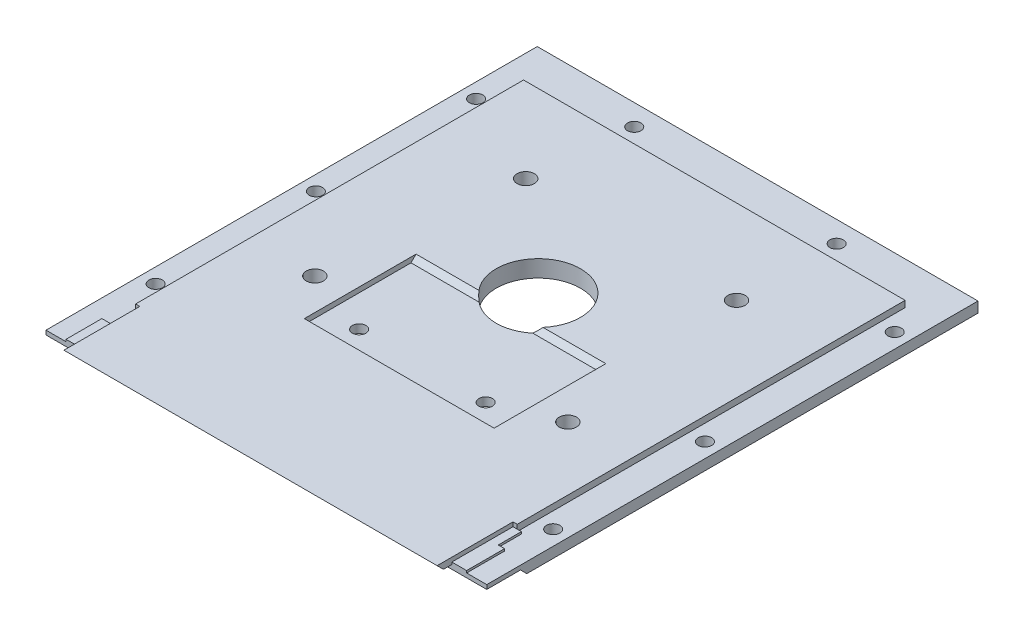
from build123d import *

# Parameters (mm, degrees)
SKETCH_1_W           = 90.5
SKETCH_1_H           = 97
EXTRUDE_1_DEPTH      = 2
SKETCH_2_W           = 104.525
SKETCH_2_H           = 124
SKETCH_2_R           = 1.6
EXTRUDE_2_DEPTH      = 2.5
SKETCH_3_W           = 88.5
SKETCH_3_H           = 17
EXTRUDE_3_DEPTH      = 2
SKETCH_4_W           = 1
SKETCH_4_H           = 5
CUT_EXTRUDE_1_DEPTH  = 2
CUT_EXTRUDE_2_DEPTH  = 150.601890446
SKETCH_6_W           = 45
SKETCH_6_H           = 25
CUT_EXTRUDE_3_DEPTH  = 1.7
CUT_EXTRUDE_4_REACH  = 146.972
SKETCH_7_R           = 1.6
CHAMFER_1_SIZE       = 2
CUT_EXTRUDE_5_REACH  = 147.014
SKETCH_8_R           = 2.05
CUT_EXTRUDE_6_REACH  = 147.014
SKETCH_9_R           = 10
CUT_EXTRUDE_7_DEPTH  = 0.8
CUT_EXTRUDE_8_REACH  = 151.602
SKETCH_11_W          = 6.5
SKETCH_11_H          = 2.5
CHAMFER_2_SIZE       = 2
SKETCH_12_W          = 104.525
SKETCH_12_H          = 9.5
EXTRUDE_4_DEPTH      = 1
SKETCH_13_W          = 2
SKETCH_13_H          = 14.5
EXTRUDE_5_DEPTH      = 0.5
SKETCH_14_W          = 1.5
SKETCH_14_H          = 9
SKETCH_14_W_2        = 1
EXTRUDE_6_DEPTH      = 0.5
SKETCH_15_W          = 88.5
SKETCH_15_H          = 2.828427125
EXTRUDE_7_DEPTH      = 2
CUT_EXTRUDE_9_DEPTH  = 0.5
SKETCH_17_W          = 2
SKETCH_17_H          = 6
CUT_EXTRUDE_10_DEPTH = 0.5


with BuildPart() as part:
    # 草图1 → 凸台-拉伸1 (new body)
    with BuildSketch(Plane(origin=(0, 0, 0), x_dir=(1, 0, 0), z_dir=(0, 1, 0))):
        with Locations((45.25, 48.5)):
            Rectangle(SKETCH_1_W, SKETCH_1_H)
    extrude(amount=EXTRUDE_1_DEPTH)

    # 草图2 → 凸台-拉伸2 (add)
    with BuildSketch(Plane.XZ):
        with Locations((45.5125, -45)):
            Rectangle(SKETCH_2_W, SKETCH_2_H)
        with Locations(Location((21.25, -102, 0), (0, 0, 270))):
            Circle(SKETCH_2_R, mode=Mode.SUBTRACT)
        with Locations(Location((69.25, -102, 0), (0, 0, 270))):
            Circle(SKETCH_2_R, mode=Mode.SUBTRACT)
        with Locations(Location((-3.25, -89, 0), (0, 0, 270))):
            Circle(SKETCH_2_R, mode=Mode.SUBTRACT)
        with Locations(Location((94.275, -90.75, 0), (0, 0, 270))):
            Circle(SKETCH_2_R, mode=Mode.SUBTRACT)
        with Locations(Location((-3.25, -13, 0), (0, 0, 270))):
            Circle(SKETCH_2_R, mode=Mode.SUBTRACT)
        with Locations(Location((-3.25, -51, 0), (0, 0, 270))):
            Circle(SKETCH_2_R, mode=Mode.SUBTRACT)
        with Locations(Location((94.275, -9.75, 0), (0, 0, 270))):
            Circle(SKETCH_2_R, mode=Mode.SUBTRACT)
        with Locations(Location((94.275, -45.75, 0), (0, 0, 270))):
            Circle(SKETCH_2_R, mode=Mode.SUBTRACT)
    extrude(amount=EXTRUDE_2_DEPTH)

    # 草图3 → 凸台-拉伸3 (add)
    with BuildSketch(Plane(origin=(0, 0, 0), x_dir=(1, 0, 0), z_dir=(0, 1, 0))):
        with Locations((45.25, -8.5)):
            Rectangle(SKETCH_3_W, SKETCH_3_H)
    extrude(amount=EXTRUDE_3_DEPTH)

    # 草图4 → 切除-拉伸1 (cut)
    with BuildSketch(Plane(origin=(0, 0, 0), x_dir=(1, 0, 0), z_dir=(0, 1, 0))):
        with Locations((0.5, 2.5)):
            Rectangle(SKETCH_4_W, SKETCH_4_H)
        with Locations((90, 2.5)):
            Rectangle(SKETCH_4_W, SKETCH_4_H)
    extrude(amount=CUT_EXTRUDE_1_DEPTH, mode=Mode.SUBTRACT)

    # 草图5 → 切除-拉伸2 (cut, through all)
    with BuildSketch(Plane(origin=(97.775, 0, 0), x_dir=(0, 0, -1), z_dir=(1, 0, 0))):
        Polygon((-8.5, -2.5), (-8.5, 0), (-9.5, 0), (-11.5, 2), (-17, 2), (-17, -2.5), align=None)
    extrude(amount=-CUT_EXTRUDE_2_DEPTH, mode=Mode.SUBTRACT)

    # 草图6 → 切除-拉伸3 (cut)
    with BuildSketch(Plane(origin=(0, 2, 0), x_dir=(1, 0, 0), z_dir=(0, 1, 0))):
        with Locations((45.5125, 34.5)):
            Rectangle(SKETCH_6_W, SKETCH_6_H)
    extrude(amount=-CUT_EXTRUDE_3_DEPTH, mode=Mode.SUBTRACT)

    # 草图7 → 切除-拉伸4 (cut, up to next)
    with BuildSketch(Plane(origin=(0, 0.3, 0), x_dir=(1, 0, 0), z_dir=(0, 1, 0)), mode=Mode.PRIVATE) as cut_extrude_4_sk1:
        with Locations(Location((30.5125, 27.5, 0), (0, 0, 270))):
            Circle(SKETCH_7_R)
    cut_extrude_4_tool1 = extrude(cut_extrude_4_sk1.sketch, amount=-CUT_EXTRUDE_4_REACH, mode=Mode.PRIVATE) & part.part
    # 草图7 → 切除-拉伸4 (cut, up to next)
    with BuildSketch(Plane(origin=(0, 0.3, 0), x_dir=(1, 0, 0), z_dir=(0, 1, 0)), mode=Mode.PRIVATE) as cut_extrude_4_sk2:
        with Locations(Location((60.5125, 27.5, 0), (0, 0, 270))):
            Circle(SKETCH_7_R)
    cut_extrude_4_tool2 = extrude(cut_extrude_4_sk2.sketch, amount=-CUT_EXTRUDE_4_REACH, mode=Mode.PRIVATE) & part.part
    add(cut_extrude_4_tool1.solids().sort_by_distance((30.5125, 0.3, -27.5))[0], mode=Mode.SUBTRACT)
    add(cut_extrude_4_tool2.solids().sort_by_distance((60.5125, 0.3, -27.5))[0], mode=Mode.SUBTRACT)

    # 倒角1
    # the kernel refuses this chamfer: 2 mm, written as the material it adds along each edge
    # the kernel refuses this chamfer: 2 mm, written as the material it takes off along each edge
    with BuildSketch(Plane(origin=(23.0125, 2, -47), x_dir=(0, 0.027495876610586296, -0.9996219169112968), z_dir=(1, 0, 0))) as chamfer_1_2_piece_1_section:
        Polygon((CHAMFER_1_SIZE * 0.999621916911, -CHAMFER_1_SIZE * 0.0274958766106), (-CHAMFER_1_SIZE * 0.0274958766106, -CHAMFER_1_SIZE * 0.999621916911), (0, 0), align=None)
    chamfer_1_2_piece_1 = extrude(amount=45, mode=Mode.PRIVATE)
    chamfer_1_2_piece_1 = split(chamfer_1_2_piece_1, bisect_by=Plane(origin=(45.5125, 0.3, -47.679710145), z_dir=(0, 1, 0)), keep=Keep.TOP, mode=Mode.PRIVATE)
    add(chamfer_1_2_piece_1, mode=Mode.SUBTRACT)

    # 草图8 → 切除-拉伸5 (cut, up to next)
    with BuildSketch(Plane(origin=(0, 2, 0), x_dir=(1, 0, 0), z_dir=(0, 1, 0)), mode=Mode.PRIVATE) as cut_extrude_5_sk1:
        with Locations(Location((20.5125, 77, 0), (0, 0, 270))):
            Circle(SKETCH_8_R)
    cut_extrude_5_tool1 = extrude(cut_extrude_5_sk1.sketch, amount=-CUT_EXTRUDE_5_REACH, mode=Mode.PRIVATE) & part.part
    # 草图8 → 切除-拉伸5 (cut, up to next)
    with BuildSketch(Plane(origin=(0, 2, 0), x_dir=(1, 0, 0), z_dir=(0, 1, 0)), mode=Mode.PRIVATE) as cut_extrude_5_sk2:
        with Locations(Location((70.5125, 77, 0), (0, 0, 270))):
            Circle(SKETCH_8_R)
    cut_extrude_5_tool2 = extrude(cut_extrude_5_sk2.sketch, amount=-CUT_EXTRUDE_5_REACH, mode=Mode.PRIVATE) & part.part
    # 草图8 → 切除-拉伸5 (cut, up to next)
    with BuildSketch(Plane(origin=(0, 2, 0), x_dir=(1, 0, 0), z_dir=(0, 1, 0)), mode=Mode.PRIVATE) as cut_extrude_5_sk3:
        with Locations(Location((15.5125, 32, 0), (0, 0, 270))):
            Circle(SKETCH_8_R)
    cut_extrude_5_tool3 = extrude(cut_extrude_5_sk3.sketch, amount=-CUT_EXTRUDE_5_REACH, mode=Mode.PRIVATE) & part.part
    # 草图8 → 切除-拉伸5 (cut, up to next)
    with BuildSketch(Plane(origin=(0, 2, 0), x_dir=(1, 0, 0), z_dir=(0, 1, 0)), mode=Mode.PRIVATE) as cut_extrude_5_sk4:
        with Locations(Location((75.5125, 32, 0), (0, 0, 270))):
            Circle(SKETCH_8_R)
    cut_extrude_5_tool4 = extrude(cut_extrude_5_sk4.sketch, amount=-CUT_EXTRUDE_5_REACH, mode=Mode.PRIVATE) & part.part
    add(cut_extrude_5_tool1.solids().sort_by_distance((20.5125, 2, -77))[0], mode=Mode.SUBTRACT)
    add(cut_extrude_5_tool2.solids().sort_by_distance((70.5125, 2, -77))[0], mode=Mode.SUBTRACT)
    add(cut_extrude_5_tool3.solids().sort_by_distance((15.5125, 2, -32))[0], mode=Mode.SUBTRACT)
    add(cut_extrude_5_tool4.solids().sort_by_distance((75.5125, 2, -32))[0], mode=Mode.SUBTRACT)

    # 草图9 → 切除-拉伸6 (cut, up to next)
    with BuildSketch(Plane(origin=(0, 2, 0), x_dir=(1, 0, 0), z_dir=(0, 1, 0)), mode=Mode.PRIVATE) as cut_extrude_6_sk1:
        with Locations(Location((45.5125, 55, 0), (0, 0, 230.353888853))):
            Circle(SKETCH_9_R)
    cut_extrude_6_tool1 = extrude(cut_extrude_6_sk1.sketch, amount=-CUT_EXTRUDE_6_REACH, mode=Mode.PRIVATE) & part.part
    add(cut_extrude_6_tool1.solids().sort_by_distance((45.5125, 2, -55))[0], mode=Mode.SUBTRACT)

    # 草图10 → 切除-拉伸7 (cut)
    with BuildSketch(Plane.XZ.offset(2.5)):
        Polygon((27.7625, -25.91228676), (27.7625, -29.08771324), (30.5125, -30.675426481), (33.2625, -29.08771324), (33.2625, -25.91228676), (30.5125, -24.324573519), align=None)
        Polygon((57.7625, -25.91228676), (57.7625, -29.08771324), (60.5125, -30.675426481), (63.2625, -29.08771324), (63.2625, -25.91228676), (60.5125, -24.324573519), align=None)
    extrude(amount=-CUT_EXTRUDE_7_DEPTH, mode=Mode.SUBTRACT)

    # 草图11 → 切除-拉伸8 (cut, up to next)
    with BuildSketch(Plane(origin=(97.775, 0, 0), x_dir=(0, 0, -1), z_dir=(1, 0, 0)), mode=Mode.PRIVATE) as cut_extrude_8_sk1:
        with Locations((-5.25, -1.25)):
            Rectangle(SKETCH_11_W, SKETCH_11_H)
    cut_extrude_8_tool1 = extrude(cut_extrude_8_sk1.sketch, amount=-CUT_EXTRUDE_8_REACH, mode=Mode.PRIVATE) & part.part
    add(cut_extrude_8_tool1.solids().sort_by_distance((97.775, -1.25, 5.25))[0], mode=Mode.SUBTRACT)

    # 倒角2
    chamfer_2_edges = [part.edges().sort_by_distance(p)[0] for p in [
        (45.5125, -2.5, 2),
    ]]
    chamfer(chamfer_2_edges, length=CHAMFER_2_SIZE)

    # 草图12 → 凸台-拉伸4 (add)
    with BuildSketch(Plane.XZ):
        with Locations((45.5125, 4.75)):
            Rectangle(SKETCH_12_W, SKETCH_12_H)
    extrude(amount=EXTRUDE_4_DEPTH)

    # 草图13 → 凸台-拉伸5 (add)
    with BuildSketch(Plane(origin=(0, 0, 0), x_dir=(1, 0, 0), z_dir=(0, 1, 0))):
        with Locations((0, -2.25)):
            Rectangle(SKETCH_13_W, SKETCH_13_H)
        with Locations((90.5, -2.25)):
            Rectangle(SKETCH_13_W, SKETCH_13_H)
    extrude(amount=EXTRUDE_5_DEPTH)

    # 草图14 → 凸台-拉伸6 (add)
    with BuildSketch(Plane(origin=(0, 0, 0), x_dir=(1, 0, 0), z_dir=(0, 1, 0))):
        with Locations((92.25, -5)):
            Rectangle(SKETCH_14_W, SKETCH_14_H)
        with Locations((-1.5, -5)):
            Rectangle(SKETCH_14_W_2, SKETCH_14_H)
    extrude(amount=EXTRUDE_6_DEPTH)

    # 草图15 → 凸台-拉伸7 (add, along a direction that is not the sketch's normal)
    with BuildSketch(Plane(origin=(0, -4.75, 4.75), x_dir=(1, 0, 0), z_dir=(0, -0.7071067811865501, 0.7071067811865449))):
        with Locations((45.25, 8.131727983)):
            Rectangle(SKETCH_15_W, SKETCH_15_H)
    extrude(amount=EXTRUDE_7_DEPTH, dir=(0, 0, 1))

    # 草图16 → 切除-拉伸9 (cut)
    with BuildSketch(Plane(origin=(0, 2, 0), x_dir=(1, 0, 0), z_dir=(0, 1, 0))):
        Polygon((1, 5), (1, -13.5), (89.5, -13.5), (89.5, 5), (90.5, 5), (90.5, 97), (0, 97), (0, 5), align=None)
    extrude(amount=-CUT_EXTRUDE_9_DEPTH, mode=Mode.SUBTRACT)

    # 草图17 → 切除-拉伸10 (cut)
    with BuildSketch(Plane(origin=(0, 0.5, 0), x_dir=(1, 0, 0), z_dir=(0, 1, 0))):
        with Locations((-1, 2)):
            Rectangle(SKETCH_17_W, SKETCH_17_H)
    extrude(amount=-CUT_EXTRUDE_10_DEPTH, mode=Mode.SUBTRACT)


solid = part.part
